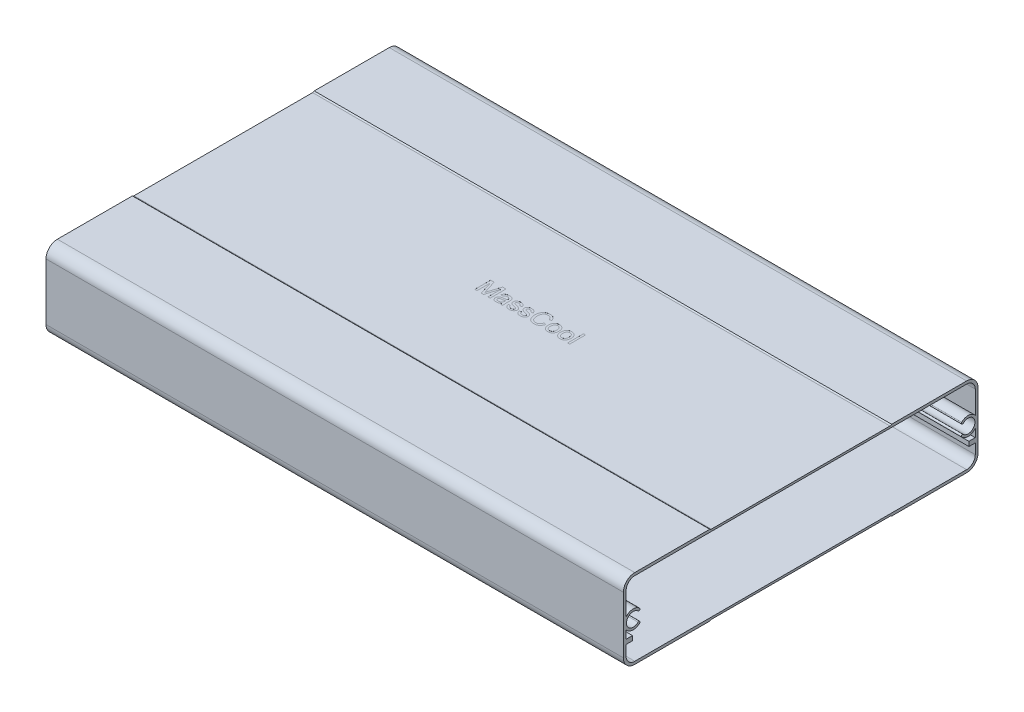
from build123d import *

# Parameters (mm, degrees)
EXTRUIR_L_MINA1_DEPTH    = 63.5
CROQUIS2_W               = 40
CROQUIS2_H               = 0.15
EXTRUIR1_DEPTH           = 134.14113752
REDONDEO1_R              = 0.5
REDONDEO1_OF_SIMETR_A1_R = 0.5
CROQUIS3_W               = 1.4
CROQUIS3_H               = 1
EXTRUIR2_DEPTH           = 127
CROQUIS4_W               = 0.448717948
CROQUIS4_H               = 3.5
EXTRUIR4_DEPTH           = 0.005


with BuildPart() as part:
    # Croquis1 → Extruir-Lámina1 (new, symmetric)
    with BuildSketch(Plane(origin=(0, 0, 0), x_dir=(0, 0, -1), z_dir=(1, 0, 0))):
        with BuildLine():
            Line((-39, -6.25), (-39, 6.25))
            ThreePointArc((-39, 6.25), (-38.267766953, 8.017766953), (-36.5, 8.75))
            Line((-36.5, 8.75), (36.5, 8.75))
            ThreePointArc((36.5, 8.75), (38.267766953, 8.017766953), (39, 6.25))
            Line((39, 6.25), (39, -6.25))
            ThreePointArc((39, -6.25), (38.267766953, -8.017766953), (36.5, -8.75))
            Line((36.5, -8.75), (-36.5, -8.75))
            ThreePointArc((-36.5, -8.75), (-38.267766953, -8.017766953), (-39, -6.25))
        make_face()
        with BuildLine():
            Line((-38.4, -6.25), (-38.4, 6.25))
            ThreePointArc((-38.4, 6.25), (-37.843502884, 7.593502884), (-36.5, 8.15))
            Line((-36.5, 8.15), (36.5, 8.15))
            ThreePointArc((36.5, 8.15), (37.843502884, 7.593502884), (38.4, 6.25))
            Line((38.4, 6.25), (38.4, -6.25))
            ThreePointArc((38.4, -6.25), (37.843502884, -7.593502884), (36.5, -8.15))
            Line((36.5, -8.15), (-36.5, -8.15))
            ThreePointArc((-36.5, -8.15), (-37.843502884, -7.593502884), (-38.4, -6.25))
        make_face(mode=Mode.SUBTRACT)
    extrude(amount=EXTRUIR_L_MINA1_DEPTH, both=True)

    # Croquis2 → Extruir1 (cut, through all)
    with BuildSketch(Plane(origin=(63.5, 0, 0), x_dir=(0, 0, -1), z_dir=(1, 0, 0))):
        with Locations((0, 8.675)):
            Rectangle(CROQUIS2_W, CROQUIS2_H)
    extruir1 = extrude(amount=-EXTRUIR1_DEPTH, mode=Mode.SUBTRACT)

    # Redondeo1
    # the kernel refuses this fillet: 0.5 mm, written as the material it adds along each edge
    with BuildSketch(Plane(origin=(63.5, 8.6, 20), x_dir=(0, 0, -1), z_dir=(-1, 0, 0))) as redondeo1_piece_1:
        with BuildLine():
            CenterArc((0.357071421, -0.5), REDONDEO1_R, 90, 45.572995999)
            Line((0, -0.15), (-0.007141428, -0.143))
            ThreePointArc((-0.007141428, -0.143), (-0.01, -0.075), (-0.01, 0))
            Line((-0.01, 0), (0, 0.01))
            Line((0, 0.01), (0.357071421, 0.01))
            Line((0.357071421, 0.01), (0.357071421, 0))
        make_face()
    extrude(amount=127)
    with BuildSketch(Plane(origin=(63.5, 8.6, -20), x_dir=(0, 1, 0), z_dir=(-1, 0, 0))) as redondeo1_piece_2:
        with BuildLine():
            CenterArc((0.5, -0.357071421), REDONDEO1_R, 134.427004001, 45.572995999)
            Line((0, -0.357071421), (-0.01, -0.357071421))
            Line((-0.01, -0.357071421), (-0.01, 0))
            Line((-0.01, 0), (0, 0.01))
            ThreePointArc((0, 0.01), (0.075, 0.01), (0.143, 0.007141428))
            Line((0.143, 0.007141428), (0.15, 0))
        make_face()
    extrude(amount=127)

    # Simetría1: Extruir1 across plane
    add(extruir1.mirror(Plane.ZX), mode=Mode.SUBTRACT)

    # Redondeo1 of Simetría1
    # the kernel refuses this fillet: 0.5 mm, written as the material it adds along each edge
    with BuildSketch(Plane(origin=(63.5, -8.6, 20), x_dir=(0, 0, -1), z_dir=(-1, 0, 0))) as redondeo1_of_simetr_a1_piece_1:
        with BuildLine():
            CenterArc((0.357071421, 0.5), REDONDEO1_OF_SIMETR_A1_R, 224.427004001, 45.572995999)
            Line((0, 0.15), (-0.007141428, 0.143))
            ThreePointArc((-0.007141428, 0.143), (-0.01, 0.075), (-0.01, 0))
            Line((-0.01, 0), (0, -0.01))
            Line((0, -0.01), (0.357071421, -0.01))
            Line((0.357071421, -0.01), (0.357071421, 0))
        make_face()
    extrude(amount=127)
    with BuildSketch(Plane(origin=(63.5, -8.6, -20), x_dir=(0, -1, 0), z_dir=(-1, 0, 0))) as redondeo1_of_simetr_a1_piece_2:
        with BuildLine():
            CenterArc((0.5, 0.357071421), REDONDEO1_OF_SIMETR_A1_R, 180, 45.572995999)
            Line((0, 0.357071421), (-0.01, 0.357071421))
            Line((-0.01, 0.357071421), (-0.01, 0))
            Line((-0.01, 0), (0, -0.01))
            ThreePointArc((0, -0.01), (0.075, -0.01), (0.143, -0.007141428))
            Line((0.143, -0.007141428), (0.15, 0))
        make_face()
    extrude(amount=127)

    # Croquis3 → Extruir2 (add, through all)
    with BuildSketch(Plane(origin=(63.5, 0, 0), x_dir=(0, 0, -1), z_dir=(1, 0, 0))):
        with Locations((-37.7, -3.5)):
            Rectangle(CROQUIS3_W, CROQUIS3_H)
        with BuildLine():
            ThreePointArc((-35.415786438, 1.414213562), (-38.83, 0), (-35.415786438, -1.414213562))
            ThreePointArc((-35.415786438, -1.414213562), (-35.415786438, -1.060660172), (-35.769339828, -1.060660172))
            ThreePointArc((-35.769339828, -1.060660172), (-38.33, 0), (-35.769339828, 1.060660172))
            ThreePointArc((-35.769339828, 1.060660172), (-35.415786438, 1.060660172), (-35.415786438, 1.414213562))
        make_face()
    extruir2 = extrude(amount=-EXTRUIR2_DEPTH)

    # Simetría2: Extruir2 across plane
    add(extruir2.mirror(Plane.XY))

    # Croquis4 → Extruir4 (cut)
    # profile 1 of 8: a face of its own
    with BuildSketch(Plane(origin=(0, 8.6, 0), x_dir=(1, 0, 0), z_dir=(0, 1, 0))):
        with BuildLine():
            Line((-8.185897436, 0), (-8.185897436, 3.5))
            Line((-8.185897436, 3.5), (-7.443409455, 3.5))
            Line((-7.443409455, 3.5), (-6.660957532, 1.043970353))
            add(Edge.make_bspline(
                [(-6.660957532, 1.043970353), (-6.652346615, 1.016147817), (-6.635693604, 0.962340652), (-6.610999163, 0.884638156), (-6.588531362, 0.812431102), (-6.56829557, 0.745489653), (-6.549198791, 0.684146169), (-6.532663989, 0.627897283), (-6.516856181, 0.577368043), (-6.507592099, 0.545255059), (-6.503205128, 0.530048077)],
                knots=[0, 0, 0, 0, 1.300204174, 2.514519184, 3.639827924, 4.676153899, 5.636536826, 6.507959918, 7.293450077, 8, 8, 8, 8], degree=3))
            add(Edge.make_bspline(
                [(-6.503205128, 0.530048077), (-6.498319061, 0.546647827), (-6.487921199, 0.581973158), (-6.471064601, 0.637516184), (-6.453128701, 0.698980793), (-6.431664927, 0.765310508), (-6.409291482, 0.837545834), (-6.38580764, 0.915626782), (-6.358719486, 0.998773807), (-6.340718053, 1.05633777), (-6.331430288, 1.08603766)],
                knots=[0, 0, 0, 0, 0.713638162, 1.518667645, 2.393860736, 3.354087503, 4.393659122, 5.512594909, 6.716633584, 8, 8, 8, 8], degree=3))
            Line((-6.331430288, 1.08603766), (-5.556690705, 3.5))
            Line((-5.556690705, 3.5), (-4.820512821, 3.5))
            Line((-4.820512821, 3.5), (-4.820512821, 0))
            Line((-4.820512821, 0), (-5.314102564, 0))
            Line((-5.314102564, 0), (-5.314102564, 2.961538462))
            Line((-5.314102564, 2.961538462), (-6.247996795, 0))
            Line((-6.247996795, 0), (-6.764022436, 0))
            Line((-6.764022436, 0), (-7.692307692, 2.961538462))
            Line((-7.692307692, 2.961538462), (-7.692307692, 0))
            Line((-7.692307692, 0), (-8.185897436, 0))
        make_face()
    # profile 2 of 8: a face of its own
    with BuildSketch(Plane(origin=(0, 8.6, 0), x_dir=(1, 0, 0), z_dir=(0, 1, 0))):
        with BuildLine():
            add(Edge.make_bspline(
                [(-2.576923077, 0.314102564), (-2.616248818, 0.283172933), (-2.692014573, 0.223583289), (-2.807758337, 0.146453271), (-2.919620071, 0.082936156), (-3.029832525, 0.034370061), (-3.140445578, -0.001024815), (-3.253289798, -0.026270517), (-3.37012987, -0.042339805), (-3.449533452, -0.044020062), (-3.489783654, -0.044871795)],
                knots=[0, 0, 0, 0, 1.197047628, 2.306255791, 3.325459075, 4.272204958, 5.183179809, 6.100503351, 7.037132558, 8, 8, 8, 8], degree=3))
            add(Edge.make_bspline(
                [(-3.489783654, -0.044871795), (-3.522521062, -0.044108535), (-3.586022182, -0.042628032), (-3.678462159, -0.033784669), (-3.765010282, -0.017667492), (-3.845812283, 0.004956473), (-3.921437222, 0.032427705), (-3.990540172, 0.068029392), (-4.054064675, 0.109257027), (-4.110883004, 0.157218259), (-4.161246611, 0.209938232), (-4.205842419, 0.266009361), (-4.243079755, 0.32617906), (-4.274240742, 0.389446448), (-4.298267992, 0.456708627), (-4.314854875, 0.527512417), (-4.324836664, 0.601746108), (-4.326218684, 0.652245857), (-4.326923077, 0.677984776)],
                knots=[0, 0, 0, 0, 1.258692688, 2.441500428, 3.565802525, 4.638326649, 5.664695568, 6.653201623, 7.620115754, 8.570354797, 9.504485475, 10.41940588, 11.319425392, 12.219534596, 13.126122865, 14.058869773, 15.010636805, 16, 16, 16, 16], degree=3))
            add(Edge.make_bspline(
                [(-4.326923077, 0.677984776), (-4.326086635, 0.708440258), (-4.324441068, 0.768356574), (-4.308247977, 0.855868026), (-4.283298472, 0.939452308), (-4.247151628, 1.017780048), (-4.203294008, 1.090402939), (-4.152307614, 1.156108629), (-4.095671309, 1.21486292), (-4.031561948, 1.264739675), (-3.962775365, 1.307804815), (-3.890033703, 1.346143112), (-3.813017394, 1.378388345), (-3.759393832, 1.39518277), (-3.732371795, 1.403645833)],
                knots=[0, 0, 0, 0, 1.081160721, 2.127011708, 3.15154375, 4.173548368, 5.183333295, 6.160067524, 7.123185218, 8.075175306, 9.03822139, 10.004020623, 10.994184154, 12, 12, 12, 12], degree=3))
            add(Edge.make_bspline(
                [(-3.732371795, 1.403645833), (-3.709526467, 1.409517335), (-3.658793207, 1.422556344), (-3.574080016, 1.437588856), (-3.474144813, 1.454192603), (-3.402183811, 1.463276278), (-3.363581731, 1.468149038)],
                knots=[0, 0, 0, 0, 0.755247122, 1.677198421, 2.753978269, 4, 4, 4, 4], degree=3))
            add(Edge.make_bspline(
                [(-3.363581731, 1.468149038), (-3.323143643, 1.473471342), (-3.245021924, 1.483753419), (-3.131774026, 1.499533529), (-3.026844947, 1.517064031), (-2.930163546, 1.535503145), (-2.841565803, 1.553158117), (-2.76168623, 1.572980318), (-2.689787671, 1.593020975), (-2.645106971, 1.608186125), (-2.623898237, 1.615384615)],
                knots=[0, 0, 0, 0, 1.295688514, 2.50312072, 3.632112522, 4.674678079, 5.629835945, 6.501350263, 7.28863104, 8, 8, 8, 8], degree=3))
            add(Edge.make_bspline(
                [(-2.623898237, 1.615384615), (-2.623661038, 1.627771029), (-2.623231377, 1.650207725), (-2.622704288, 1.680126268), (-2.621674077, 1.702551814), (-2.621760599, 1.714943354), (-2.621794872, 1.719851763)],
                knots=[0, 0, 0, 0, 1.422721786, 2.577112132, 3.436380362, 4, 4, 4, 4], degree=3))
            add(Edge.make_bspline(
                [(-2.621794872, 1.719851763), (-2.622303414, 1.739489586), (-2.623279744, 1.777191463), (-2.627774744, 1.831654535), (-2.637009102, 1.881593105), (-2.649452578, 1.927171547), (-2.665244929, 1.968482926), (-2.686165019, 2.004221394), (-2.70902272, 2.036843141), (-2.728031273, 2.054583258), (-2.737479968, 2.063401442)],
                knots=[0, 0, 0, 0, 1.26154989, 2.42199954, 3.505345601, 4.517638791, 5.454101631, 6.334651141, 7.172195178, 8, 8, 8, 8], degree=3))
            add(Edge.make_bspline(
                [(-2.737479968, 2.063401442), (-2.750994297, 2.074316702), (-2.778627941, 2.096635858), (-2.826196877, 2.123150851), (-2.877191579, 2.147472919), (-2.933509403, 2.166323876), (-2.994310104, 2.180802164), (-3.05993528, 2.191247639), (-3.130215638, 2.197607533), (-3.178705329, 2.198339998), (-3.203725962, 2.198717949)],
                knots=[0, 0, 0, 0, 0.839762797, 1.717118621, 2.62848608, 3.573318781, 4.586191294, 5.652292021, 6.78858503, 8, 8, 8, 8], degree=3))
            add(Edge.make_bspline(
                [(-3.203725962, 2.198717949), (-3.227104276, 2.198479218), (-3.272032023, 2.198020432), (-3.337306348, 2.193664544), (-3.397724955, 2.186957522), (-3.453701192, 2.177125028), (-3.504506542, 2.164621166), (-3.551098528, 2.149898481), (-3.592829591, 2.132054972), (-3.642435488, 2.103392712), (-3.698256079, 2.05745826), (-3.752907416, 1.984718908), (-3.800877402, 1.896927182), (-3.822107666, 1.830170114), (-3.833333333, 1.794871795)],
                knots=[0, 0, 0, 0, 1.022193202, 1.964420342, 2.859404845, 3.679355848, 4.447752811, 5.145854219, 5.814144269, 6.427678132, 7.647232431, 8.943346363, 10.383770637, 12, 12, 12, 12], degree=3))
            Line((-3.833333333, 1.794871795), (-4.282051282, 1.83974359))
            add(Edge.make_bspline(
                [(-4.282051282, 1.83974359), (-4.271755374, 1.88184837), (-4.251874605, 1.963150128), (-4.208130185, 2.076542567), (-4.155184819, 2.177244486), (-4.093154919, 2.26713918), (-4.016909118, 2.344677067), (-3.927477232, 2.412930671), (-3.822525365, 2.469833794), (-3.704253725, 2.518114416), (-3.573590155, 2.556178227), (-3.432044753, 2.583232744), (-3.280757372, 2.599391614), (-3.176656528, 2.601486361), (-3.123096955, 2.602564103)],
                knots=[0, 0, 0, 0, 1.021253436, 1.971977998, 2.856928585, 3.699335328, 4.537187707, 5.410097588, 6.342486875, 7.343316183, 8.417452201, 9.545747471, 10.737294414, 12, 12, 12, 12], degree=3))
            add(Edge.make_bspline(
                [(-3.123096955, 2.602564103), (-3.070713874, 2.601648518), (-2.970884667, 2.59990364), (-2.828975689, 2.586217164), (-2.702268737, 2.562967528), (-2.591054268, 2.529287948), (-2.494378014, 2.488319418), (-2.410909274, 2.443235009), (-2.341038784, 2.392543899), (-2.284089281, 2.335921734), (-2.238402431, 2.272575511), (-2.201469217, 2.202489752), (-2.170621389, 2.125241487), (-2.156988167, 2.070149019), (-2.149939904, 2.041666667)],
                knots=[0, 0, 0, 0, 1.532418085, 2.920410157, 4.166262907, 5.295392887, 6.3126657, 7.233843889, 8.065362582, 8.82930282, 9.573337446, 10.341184706, 11.142406151, 12, 12, 12, 12], degree=3))
            add(Edge.make_bspline(
                [(-2.149939904, 2.041666667), (-2.146315784, 2.019972934), (-2.137977637, 1.970061364), (-2.133315773, 1.884184635), (-2.12865643, 1.778100821), (-2.128364325, 1.700464733), (-2.128205128, 1.658153045)],
                knots=[0, 0, 0, 0, 0.685842966, 1.577944182, 2.67997895, 4, 4, 4, 4], degree=3))
            Line((-2.128205128, 1.658153045), (-2.128205128, 1.110576923))
            add(Edge.make_bspline(
                [(-2.128205128, 1.110576923), (-2.127947136, 1.064770409), (-2.127454845, 0.977363986), (-2.127130078, 0.852323027), (-2.125202697, 0.739656375), (-2.121296766, 0.638951045), (-2.118070729, 0.550354542), (-2.114171159, 0.473644993), (-2.108607829, 0.409354942), (-2.100376774, 0.339930966), (-2.086024908, 0.262085488), (-2.061710003, 0.172768826), (-2.032161723, 0.084759209), (-2.006473732, 0.028311657), (-1.993589744, 0)],
                knots=[0, 0, 0, 0, 1.460752392, 2.787357723, 3.987454144, 5.053844556, 6.001073417, 6.814649835, 7.502887566, 8.058452826, 9.043678907, 10.023506295, 11.008675999, 12, 12, 12, 12], degree=3))
            Line((-1.993589744, 0), (-2.442307692, 0))
            add(Edge.make_bspline(
                [(-2.442307692, 0), (-2.458916947, 0.022933991), (-2.492110451, 0.068767446), (-2.529268841, 0.145901761), (-2.559863266, 0.22736247), (-2.571179961, 0.284901866), (-2.576923077, 0.314102564)],
                knots=[0, 0, 0, 0, 0.98283144, 1.964183219, 2.966842269, 4, 4, 4, 4], degree=3))
        make_face()
        with BuildLine():
            add(Edge.make_bspline(
                [(-2.621794872, 1.211538462), (-2.641578675, 1.204500718), (-2.683330103, 1.189648375), (-2.750671591, 1.171766266), (-2.824249699, 1.152127669), (-2.905403079, 1.135251535), (-2.99313259, 1.117379239), (-3.088371443, 1.101523741), (-3.190283985, 1.086126652), (-3.260734276, 1.076808597), (-3.29697516, 1.072015224)],
                knots=[0, 0, 0, 0, 0.729352295, 1.539213581, 2.419656264, 3.375381672, 4.41857158, 5.530700671, 6.729748458, 8, 8, 8, 8], degree=3))
            add(Edge.make_bspline(
                [(-3.29697516, 1.072015224), (-3.336523606, 1.066747519), (-3.409518951, 1.057024811), (-3.509153586, 1.038861187), (-3.590254555, 1.020348509), (-3.655058521, 1.000789442), (-3.707712591, 0.977728488), (-3.751328109, 0.949083195), (-3.789982121, 0.916955247), (-3.821384035, 0.87936939), (-3.847032932, 0.838990713), (-3.864314466, 0.795361176), (-3.876494515, 0.750160247), (-3.877631461, 0.718965197), (-3.878205128, 0.70322516)],
                knots=[0, 0, 0, 0, 1.886220442, 3.481434204, 4.78676141, 5.817751327, 6.678319802, 7.493641666, 8.277504993, 9.045791761, 9.800124555, 10.528599956, 11.257578043, 12, 12, 12, 12], degree=3))
            add(Edge.make_bspline(
                [(-3.878205128, 0.70322516), (-3.876883272, 0.679390549), (-3.8742853, 0.632546093), (-3.848702015, 0.566340287), (-3.808888523, 0.506459646), (-3.753519544, 0.45350231), (-3.68222084, 0.410716546), (-3.596314878, 0.379982388), (-3.496346254, 0.362263467), (-3.425121711, 0.360112792), (-3.387419872, 0.358974359)],
                knots=[0, 0, 0, 0, 0.849267971, 1.669148087, 2.501462232, 3.405991702, 4.385156294, 5.453560725, 6.652073551, 8, 8, 8, 8], degree=3))
            add(Edge.make_bspline(
                [(-3.387419872, 0.358974359), (-3.348753467, 0.359990651), (-3.27295862, 0.361982812), (-3.162833348, 0.3834258), (-3.058784568, 0.415821541), (-2.96315563, 0.462572735), (-2.876749165, 0.517942573), (-2.801948213, 0.58068383), (-2.738244421, 0.649101318), (-2.706313124, 0.700778308), (-2.690504808, 0.726362179)],
                knots=[0, 0, 0, 0, 1.124426932, 2.204129629, 3.254288104, 4.289056288, 5.293189312, 6.235005055, 7.126199027, 8, 8, 8, 8], degree=3))
            add(Edge.make_bspline(
                [(-2.690504808, 0.726362179), (-2.679844885, 0.748494465), (-2.656922274, 0.79608672), (-2.638884729, 0.879430716), (-2.625691442, 0.975521745), (-2.62452236, 1.044373029), (-2.623898237, 1.081129808)],
                knots=[0, 0, 0, 0, 0.806621552, 1.73452216, 2.790557523, 4, 4, 4, 4], degree=3))
            Line((-2.623898237, 1.081129808), (-2.621794872, 1.211538462))
        make_face(mode=Mode.SUBTRACT)
    # profile 3 of 8: a face of its own
    with BuildSketch(Plane(origin=(0, 8.6, 0), x_dir=(1, 0, 0), z_dir=(0, 1, 0))):
        with BuildLine():
            Line((-1.634615385, 0.807692308), (-1.185897436, 0.852564103))
            add(Edge.make_bspline(
                [(-1.185897436, 0.852564103), (-1.179043643, 0.814590177), (-1.16591743, 0.741863469), (-1.125602898, 0.641635466), (-1.071210525, 0.554951113), (-1.012622701, 0.494566819), (-0.958135356, 0.455663093), (-0.913821178, 0.429246416), (-0.865107158, 0.407913494), (-0.81318371, 0.389457753), (-0.757308652, 0.375472937), (-0.697506792, 0.36575554), (-0.633748581, 0.360306353), (-0.58995401, 0.359425713), (-0.567508013, 0.358974359)],
                knots=[0, 0, 0, 0, 1.576426584, 3.019132651, 4.39139761, 5.744583744, 6.429748217, 7.128801231, 7.852561526, 8.603024018, 9.382742032, 10.206978913, 11.081024327, 12, 12, 12, 12], degree=3))
            add(Edge.make_bspline(
                [(-0.567508013, 0.358974359), (-0.545056132, 0.359090719), (-0.501477206, 0.359316574), (-0.438551119, 0.365397146), (-0.379945798, 0.373480416), (-0.325929767, 0.385165299), (-0.276615616, 0.40089548), (-0.231122476, 0.418721833), (-0.190627429, 0.441263872), (-0.143681075, 0.474334229), (-0.095277154, 0.521170879), (-0.051082563, 0.583297227), (-0.023933567, 0.651591474), (-0.020803795, 0.699019313), (-0.019230769, 0.722856571)],
                knots=[0, 0, 0, 0, 1.101207713, 2.137435615, 3.099211963, 4.003546554, 4.845050796, 5.637285753, 6.396976949, 7.112904354, 8.451176697, 9.67915534, 10.8335422, 12, 12, 12, 12], degree=3))
            add(Edge.make_bspline(
                [(-0.019230769, 0.722856571), (-0.019484057, 0.733665971), (-0.019981221, 0.754883085), (-0.028379684, 0.785284481), (-0.040311904, 0.814018646), (-0.057529493, 0.840905058), (-0.079342254, 0.866049718), (-0.10592732, 0.889655423), (-0.137337041, 0.911162133), (-0.16071901, 0.923384674), (-0.172776442, 0.9296875)],
                knots=[0, 0, 0, 0, 0.948511305, 1.861774925, 2.756066261, 3.680846901, 4.658374041, 5.678500434, 6.80286706, 8, 8, 8, 8], degree=3))
            add(Edge.make_bspline(
                [(-0.172776442, 0.9296875), (-0.182778108, 0.934243588), (-0.204633013, 0.944199215), (-0.241399796, 0.957737109), (-0.284062217, 0.973723947), (-0.33381652, 0.98831714), (-0.389557882, 1.005491994), (-0.451768535, 1.023983055), (-0.521027325, 1.041535607), (-0.569155045, 1.054213098), (-0.594150641, 1.060797276)],
                knots=[0, 0, 0, 0, 0.596822396, 1.30413245, 2.127382897, 3.071041962, 4.119245502, 5.296370109, 6.595843667, 8, 8, 8, 8], degree=3))
            add(Edge.make_bspline(
                [(-0.594150641, 1.060797276), (-0.628289788, 1.070786271), (-0.69407564, 1.090034982), (-0.788730834, 1.118786236), (-0.876182413, 1.146234048), (-0.956487438, 1.172501358), (-1.029274094, 1.198615852), (-1.094905153, 1.222940788), (-1.152934592, 1.246996745), (-1.220242316, 1.275715787), (-1.29430878, 1.316123756), (-1.372660462, 1.373140078), (-1.438966786, 1.439685161), (-1.493972294, 1.513616454), (-1.537149251, 1.593927662), (-1.567037439, 1.679407762), (-1.586144753, 1.768792192), (-1.588532838, 1.829830835), (-1.58974359, 1.860777244)],
                knots=[0, 0, 0, 0, 1.22605552, 2.362598816, 3.409724438, 4.385374865, 5.274589806, 6.075051486, 6.797583358, 7.439654886, 8.596878446, 9.697305961, 10.768176168, 11.821850251, 12.863383541, 13.897821176, 14.934201653, 16, 16, 16, 16], degree=3))
            add(Edge.make_bspline(
                [(-1.58974359, 1.860777244), (-1.588773194, 1.888882567), (-1.586852524, 1.944510438), (-1.572367897, 2.026158023), (-1.549301992, 2.104927941), (-1.51599705, 2.179759045), (-1.475197835, 2.250371308), (-1.425908262, 2.31435767), (-1.371693869, 2.373592521), (-1.329654024, 2.406561026), (-1.30859375, 2.423076923)],
                knots=[0, 0, 0, 0, 1.034021226, 2.046601578, 3.042752055, 4.048071569, 5.054273975, 6.036661087, 7.016446045, 8, 8, 8, 8], degree=3))
            add(Edge.make_bspline(
                [(-1.30859375, 2.423076923), (-1.29104092, 2.435322972), (-1.254264138, 2.460980958), (-1.192108762, 2.494555173), (-1.120778928, 2.524406287), (-1.041797343, 2.551150743), (-0.957041523, 2.574684656), (-0.868029843, 2.590215459), (-0.776215768, 2.600522884), (-0.714071492, 2.60187633), (-0.682491987, 2.602564103)],
                knots=[0, 0, 0, 0, 0.776203524, 1.626305774, 2.557252601, 3.57906176, 4.650888526, 5.745456612, 6.854321437, 8, 8, 8, 8], degree=3))
            add(Edge.make_bspline(
                [(-0.682491987, 2.602564103), (-0.635471882, 2.601484033), (-0.544179926, 2.599387021), (-0.411720583, 2.58329884), (-0.288242882, 2.555910991), (-0.174402056, 2.518577246), (-0.072021203, 2.471898318), (0.017652976, 2.417554432), (0.09211846, 2.353762639), (0.153541395, 2.281892621), (0.202790882, 2.199439786), (0.242207346, 2.105588312), (0.273898659, 1.999502492), (0.287673554, 1.924046068), (0.294871795, 1.884615385)],
                knots=[0, 0, 0, 0, 1.253394935, 2.433530808, 3.550681177, 4.620594829, 5.621516506, 6.544862206, 7.406547904, 8.22431151, 9.054607538, 9.956211395, 10.931993099, 12, 12, 12, 12], degree=3))
            Line((0.294871795, 1.884615385), (-0.153846154, 1.83974359))
            add(Edge.make_bspline(
                [(-0.153846154, 1.83974359), (-0.159184476, 1.86665571), (-0.169542804, 1.918875225), (-0.200903825, 1.991161225), (-0.245436465, 2.053389357), (-0.30199118, 2.106210839), (-0.370792952, 2.148908896), (-0.45303122, 2.177841566), (-0.547045094, 2.196392842), (-0.614150198, 2.197915139), (-0.649539263, 2.198717949)],
                knots=[0, 0, 0, 0, 0.971549383, 1.88516682, 2.771115596, 3.668786025, 4.614654303, 5.622170142, 6.746009326, 8, 8, 8, 8], degree=3))
            add(Edge.make_bspline(
                [(-0.649539263, 2.198717949), (-0.670812687, 2.19846492), (-0.711768397, 2.197977788), (-0.771005599, 2.193818491), (-0.825463283, 2.186631607), (-0.875618906, 2.17820423), (-0.920417752, 2.165162976), (-0.961158984, 2.150843045), (-0.996707575, 2.132507018), (-1.037024413, 2.106242193), (-1.077140055, 2.068213196), (-1.114629631, 2.018827641), (-1.136989675, 1.963723799), (-1.139680824, 1.925467535), (-1.141025641, 1.90635016)],
                knots=[0, 0, 0, 0, 1.202032812, 2.314159929, 3.352655878, 4.305866621, 5.183839704, 5.986040797, 6.742017283, 7.437935182, 8.699432998, 9.843179159, 10.922196019, 12, 12, 12, 12], degree=3))
            add(Edge.make_bspline(
                [(-1.141025641, 1.90635016), (-1.140574396, 1.894130541), (-1.139684524, 1.870033017), (-1.129941388, 1.835250911), (-1.115148991, 1.802256745), (-1.101179387, 1.782511966), (-1.094050481, 1.772435897)],
                knots=[0, 0, 0, 0, 1.012137305, 1.99597066, 2.977312565, 4, 4, 4, 4], degree=3))
            add(Edge.make_bspline(
                [(-1.094050481, 1.772435897), (-1.085503163, 1.76227856), (-1.067717111, 1.741142231), (-1.032884691, 1.714846113), (-0.992353281, 1.690135113), (-0.961962168, 1.67694862), (-0.946113782, 1.670072115)],
                knots=[0, 0, 0, 0, 0.873299099, 1.81724178, 2.861733162, 4, 4, 4, 4], degree=3))
            add(Edge.make_bspline(
                [(-0.946113782, 1.670072115), (-0.940050057, 1.667930482), (-0.925900699, 1.662933102), (-0.90079248, 1.655286235), (-0.869070434, 1.645499395), (-0.829962482, 1.634309107), (-0.784219768, 1.620998624), (-0.731095927, 1.606295055), (-0.671328859, 1.589478784), (-0.628982316, 1.577957942), (-0.606770833, 1.571915064)],
                knots=[0, 0, 0, 0, 0.436802817, 1.019254657, 1.782618184, 2.69198815, 3.782349451, 5.018834001, 6.436327698, 8, 8, 8, 8], degree=3))
            add(Edge.make_bspline(
                [(-0.606770833, 1.571915064), (-0.573798983, 1.561927617), (-0.510124404, 1.54264006), (-0.417899203, 1.513602539), (-0.332036756, 1.486544292), (-0.252784868, 1.460660556), (-0.180196836, 1.435834029), (-0.113923334, 1.413070795), (-0.054158425, 1.391128553), (0.015943035, 1.364860398), (0.095585218, 1.329464547), (0.180085299, 1.275793356), (0.254154352, 1.213476183), (0.317006694, 1.142462278), (0.368075898, 1.062158243), (0.403448953, 0.971946482), (0.426079316, 0.87307076), (0.428326036, 0.804083376), (0.429487179, 0.768429487)],
                knots=[0, 0, 0, 0, 1.155996739, 2.232437775, 3.244329082, 4.176768736, 5.029854173, 5.818511279, 6.528027969, 7.165934889, 8.330913826, 9.444808892, 10.513164249, 11.568838208, 12.615385132, 13.688622127, 14.805439433, 16, 16, 16, 16], degree=3))
            add(Edge.make_bspline(
                [(0.429487179, 0.768429487), (0.428032728, 0.73254155), (0.425131261, 0.660949169), (0.4007459, 0.555721002), (0.362708744, 0.453320989), (0.308716277, 0.355874983), (0.240775549, 0.264783702), (0.157813894, 0.184346272), (0.061043064, 0.114977844), (-0.048223087, 0.05767444), (-0.16748696, 0.010802312), (-0.295897951, -0.020232961), (-0.431454108, -0.041996761), (-0.524647226, -0.043897513), (-0.572415865, -0.044871795)],
                knots=[0, 0, 0, 0, 0.894809563, 1.785044015, 2.682170314, 3.614214614, 4.555721535, 5.508634546, 6.486485836, 7.51727745, 8.581064401, 9.676123613, 10.808834633, 12, 12, 12, 12], degree=3))
            add(Edge.make_bspline(
                [(-0.572415865, -0.044871795), (-0.61169902, -0.044179468), (-0.687822574, -0.042837866), (-0.798424737, -0.033064683), (-0.901836476, -0.01646741), (-0.99798464, 0.007275091), (-1.086922085, 0.03747188), (-1.168901699, 0.073816686), (-1.243745015, 0.117465056), (-1.311411579, 0.168161656), (-1.372342168, 0.225941328), (-1.427786778, 0.289619704), (-1.4771203, 0.36013902), (-1.519716672, 0.437325474), (-1.557908903, 0.520362919), (-1.589986149, 0.610203791), (-1.615992467, 0.706620958), (-1.628309693, 0.773469704), (-1.634615385, 0.807692308)],
                knots=[0, 0, 0, 0, 1.244406412, 2.411431524, 3.514215425, 4.559320282, 5.545040859, 6.48623969, 7.395443761, 8.283912081, 9.158607275, 10.050831307, 10.954592804, 11.879399228, 12.840196462, 13.8472361, 14.897912238, 16, 16, 16, 16], degree=3))
        make_face()
    # profile 4 of 8: a face of its own
    with BuildSketch(Plane(origin=(0, 8.6, 0), x_dir=(1, 0, 0), z_dir=(0, 1, 0))):
        with BuildLine():
            Line((0.788461538, 0.807692308), (1.237179487, 0.852564103))
            add(Edge.make_bspline(
                [(1.237179487, 0.852564103), (1.24403328, 0.814590177), (1.257159493, 0.741863469), (1.297474025, 0.641635466), (1.351866399, 0.554951113), (1.410454222, 0.494566819), (1.464941567, 0.455663093), (1.509255745, 0.429246416), (1.557969765, 0.407913494), (1.609893213, 0.389457753), (1.665768272, 0.375472937), (1.725570131, 0.36575554), (1.789328342, 0.360306353), (1.833122913, 0.359425713), (1.85556891, 0.358974359)],
                knots=[0, 0, 0, 0, 1.576426584, 3.019132651, 4.39139761, 5.744583744, 6.429748217, 7.128801231, 7.852561526, 8.603024018, 9.382742032, 10.206978913, 11.081024327, 12, 12, 12, 12], degree=3))
            add(Edge.make_bspline(
                [(1.85556891, 0.358974359), (1.878020791, 0.359090719), (1.921599717, 0.359316574), (1.984525804, 0.365397146), (2.043131125, 0.373480416), (2.097147156, 0.385165299), (2.146461307, 0.40089548), (2.191954447, 0.418721833), (2.232449495, 0.441263872), (2.279395848, 0.474334229), (2.327799769, 0.521170879), (2.37199436, 0.583297227), (2.399143356, 0.651591474), (2.402273129, 0.699019313), (2.403846154, 0.722856571)],
                knots=[0, 0, 0, 0, 1.101207713, 2.137435615, 3.099211963, 4.003546554, 4.845050796, 5.637285753, 6.396976949, 7.112904354, 8.451176697, 9.67915534, 10.8335422, 12, 12, 12, 12], degree=3))
            add(Edge.make_bspline(
                [(2.403846154, 0.722856571), (2.403592866, 0.733665971), (2.403095702, 0.754883085), (2.394697239, 0.785284481), (2.382765019, 0.814018646), (2.36554743, 0.840905058), (2.343734669, 0.866049718), (2.317149603, 0.889655423), (2.285739882, 0.911162133), (2.262357914, 0.923384674), (2.250300481, 0.9296875)],
                knots=[0, 0, 0, 0, 0.948511305, 1.861774925, 2.756066261, 3.680846901, 4.658374041, 5.678500434, 6.80286706, 8, 8, 8, 8], degree=3))
            add(Edge.make_bspline(
                [(2.250300481, 0.9296875), (2.240298815, 0.934243588), (2.21844391, 0.944199215), (2.181677127, 0.957737109), (2.139014706, 0.973723947), (2.089260403, 0.98831714), (2.033519041, 1.005491994), (1.971308388, 1.023983055), (1.902049598, 1.041535607), (1.853921879, 1.054213098), (1.828926282, 1.060797276)],
                knots=[0, 0, 0, 0, 0.596822396, 1.30413245, 2.127382897, 3.071041962, 4.119245502, 5.296370109, 6.595843667, 8, 8, 8, 8], degree=3))
            add(Edge.make_bspline(
                [(1.828926282, 1.060797276), (1.794787135, 1.070786271), (1.729001283, 1.090034982), (1.634346089, 1.118786236), (1.54689451, 1.146234048), (1.466589485, 1.172501358), (1.393802829, 1.198615852), (1.32817177, 1.222940788), (1.270142331, 1.246996745), (1.202834607, 1.275715787), (1.128768143, 1.316123756), (1.050416461, 1.373140078), (0.984110137, 1.439685161), (0.929104629, 1.513616454), (0.885927672, 1.593927662), (0.856039484, 1.679407762), (0.83693217, 1.768792192), (0.834544085, 1.829830835), (0.833333333, 1.860777244)],
                knots=[0, 0, 0, 0, 1.22605552, 2.362598816, 3.409724438, 4.385374865, 5.274589806, 6.075051486, 6.797583358, 7.439654886, 8.596878446, 9.697305961, 10.768176168, 11.821850251, 12.863383541, 13.897821176, 14.934201653, 16, 16, 16, 16], degree=3))
            add(Edge.make_bspline(
                [(0.833333333, 1.860777244), (0.834303729, 1.888882567), (0.836224399, 1.944510438), (0.850709026, 2.026158023), (0.873774931, 2.104927941), (0.907079873, 2.179759045), (0.947879088, 2.250371308), (0.997168661, 2.31435767), (1.051383054, 2.373592521), (1.093422899, 2.406561026), (1.114483173, 2.423076923)],
                knots=[0, 0, 0, 0, 1.034021226, 2.046601578, 3.042752055, 4.048071569, 5.054273975, 6.036661087, 7.016446045, 8, 8, 8, 8], degree=3))
            add(Edge.make_bspline(
                [(1.114483173, 2.423076923), (1.132036003, 2.435322972), (1.168812785, 2.460980958), (1.230968161, 2.494555173), (1.302297995, 2.524406287), (1.38127958, 2.551150743), (1.4660354, 2.574684656), (1.55504708, 2.590215459), (1.646861155, 2.600522884), (1.709005431, 2.60187633), (1.740584936, 2.602564103)],
                knots=[0, 0, 0, 0, 0.776203524, 1.626305774, 2.557252601, 3.57906176, 4.650888526, 5.745456612, 6.854321437, 8, 8, 8, 8], degree=3))
            add(Edge.make_bspline(
                [(1.740584936, 2.602564103), (1.787605041, 2.601484033), (1.878896997, 2.599387021), (2.01135634, 2.58329884), (2.134834041, 2.555910991), (2.248674867, 2.518577246), (2.35105572, 2.471898318), (2.440729899, 2.417554432), (2.515195383, 2.353762639), (2.576618318, 2.281892621), (2.625867805, 2.199439786), (2.665284269, 2.105588312), (2.696975582, 1.999502492), (2.710750477, 1.924046068), (2.717948718, 1.884615385)],
                knots=[0, 0, 0, 0, 1.253394935, 2.433530808, 3.550681177, 4.620594829, 5.621516506, 6.544862206, 7.406547904, 8.22431151, 9.054607538, 9.956211395, 10.931993099, 12, 12, 12, 12], degree=3))
            Line((2.717948718, 1.884615385), (2.269230769, 1.83974359))
            add(Edge.make_bspline(
                [(2.269230769, 1.83974359), (2.263892447, 1.86665571), (2.253534119, 1.918875225), (2.222173098, 1.991161225), (2.177640458, 2.053389357), (2.121085743, 2.106210839), (2.052283972, 2.148908896), (1.970045703, 2.177841566), (1.876031829, 2.196392842), (1.808926725, 2.197915139), (1.77353766, 2.198717949)],
                knots=[0, 0, 0, 0, 0.971549383, 1.88516682, 2.771115596, 3.668786025, 4.614654303, 5.622170142, 6.746009326, 8, 8, 8, 8], degree=3))
            add(Edge.make_bspline(
                [(1.77353766, 2.198717949), (1.752264236, 2.19846492), (1.711308526, 2.197977788), (1.652071324, 2.193818491), (1.59761364, 2.186631607), (1.547458017, 2.17820423), (1.502659171, 2.165162976), (1.461917939, 2.150843045), (1.426369349, 2.132507018), (1.38605251, 2.106242193), (1.345936869, 2.068213196), (1.308447292, 2.018827641), (1.286087248, 1.963723799), (1.2833961, 1.925467535), (1.282051282, 1.90635016)],
                knots=[0, 0, 0, 0, 1.202032812, 2.314159929, 3.352655878, 4.305866621, 5.183839704, 5.986040797, 6.742017283, 7.437935182, 8.699432998, 9.843179159, 10.922196019, 12, 12, 12, 12], degree=3))
            add(Edge.make_bspline(
                [(1.282051282, 1.90635016), (1.282502527, 1.894130541), (1.283392399, 1.870033017), (1.293135535, 1.835250911), (1.307927933, 1.802256745), (1.321897536, 1.782511966), (1.329026442, 1.772435897)],
                knots=[0, 0, 0, 0, 1.012137305, 1.99597066, 2.977312565, 4, 4, 4, 4], degree=3))
            add(Edge.make_bspline(
                [(1.329026442, 1.772435897), (1.33757376, 1.76227856), (1.355359812, 1.741142231), (1.390192232, 1.714846113), (1.430723642, 1.690135113), (1.461114755, 1.67694862), (1.476963141, 1.670072115)],
                knots=[0, 0, 0, 0, 0.873299099, 1.81724178, 2.861733162, 4, 4, 4, 4], degree=3))
            add(Edge.make_bspline(
                [(1.476963141, 1.670072115), (1.483026866, 1.667930482), (1.497176224, 1.662933102), (1.522284443, 1.655286235), (1.554006489, 1.645499395), (1.593114441, 1.634309107), (1.638857155, 1.620998624), (1.691980996, 1.606295055), (1.751748064, 1.589478784), (1.794094607, 1.577957942), (1.81630609, 1.571915064)],
                knots=[0, 0, 0, 0, 0.436802817, 1.019254657, 1.782618184, 2.69198815, 3.782349451, 5.018834001, 6.436327698, 8, 8, 8, 8], degree=3))
            add(Edge.make_bspline(
                [(1.81630609, 1.571915064), (1.84927794, 1.561927617), (1.912952519, 1.54264006), (2.00517772, 1.513602539), (2.091040167, 1.486544292), (2.170292055, 1.460660556), (2.242880087, 1.435834029), (2.309153589, 1.413070795), (2.368918498, 1.391128553), (2.439019958, 1.364860398), (2.518662141, 1.329464547), (2.603162222, 1.275793356), (2.677231275, 1.213476183), (2.740083617, 1.142462278), (2.791152822, 1.062158243), (2.826525876, 0.971946482), (2.849156239, 0.87307076), (2.851402959, 0.804083376), (2.852564103, 0.768429487)],
                knots=[0, 0, 0, 0, 1.155996739, 2.232437775, 3.244329082, 4.176768736, 5.029854173, 5.818511279, 6.528027969, 7.165934889, 8.330913826, 9.444808892, 10.513164249, 11.568838208, 12.615385132, 13.688622127, 14.805439433, 16, 16, 16, 16], degree=3))
            add(Edge.make_bspline(
                [(2.852564103, 0.768429487), (2.851109651, 0.73254155), (2.848208184, 0.660949169), (2.823822823, 0.555721002), (2.785785668, 0.453320989), (2.7317932, 0.355874983), (2.663852472, 0.264783702), (2.580890817, 0.184346272), (2.484119987, 0.114977844), (2.374853836, 0.05767444), (2.255589963, 0.010802312), (2.127178972, -0.020232961), (1.991622815, -0.041996761), (1.898429697, -0.043897513), (1.850661058, -0.044871795)],
                knots=[0, 0, 0, 0, 0.894809563, 1.785044015, 2.682170314, 3.614214614, 4.555721535, 5.508634546, 6.486485836, 7.51727745, 8.581064401, 9.676123613, 10.808834633, 12, 12, 12, 12], degree=3))
            add(Edge.make_bspline(
                [(1.850661058, -0.044871795), (1.811377903, -0.044179468), (1.735254349, -0.042837866), (1.624652186, -0.033064683), (1.521240447, -0.01646741), (1.425092283, 0.007275091), (1.336154838, 0.03747188), (1.254175224, 0.073816686), (1.179331908, 0.117465056), (1.111665344, 0.168161656), (1.050734755, 0.225941328), (0.995290145, 0.289619704), (0.945956623, 0.36013902), (0.903360251, 0.437325474), (0.86516802, 0.520362919), (0.833090774, 0.610203791), (0.807084456, 0.706620958), (0.79476723, 0.773469704), (0.788461538, 0.807692308)],
                knots=[0, 0, 0, 0, 1.244406412, 2.411431524, 3.514215425, 4.559320282, 5.545040859, 6.48623969, 7.395443761, 8.283912081, 9.158607275, 10.050831307, 10.954592804, 11.879399228, 12.840196462, 13.8472361, 14.897912238, 16, 16, 16, 16], degree=3))
        make_face()
    # profile 5 of 8: a face of its own
    with BuildSketch(Plane(origin=(0, 8.6, 0), x_dir=(1, 0, 0), z_dir=(0, 1, 0))):
        with BuildLine():
            Line((5.814102564, 1.235376603), (6.307692308, 1.120392628))
            add(Edge.make_bspline(
                [(6.307692308, 1.120392628), (6.295326507, 1.074129833), (6.271137465, 0.983634063), (6.223312792, 0.854124599), (6.169635462, 0.732585491), (6.108803019, 0.619336895), (6.040149659, 0.51502992), (5.965494417, 0.418324021), (5.881880305, 0.33124721), (5.792375224, 0.251789802), (5.69628228, 0.18170858), (5.594760024, 0.121192159), (5.488299194, 0.069704969), (5.376469507, 0.027365065), (5.259198464, -0.004499342), (5.137089894, -0.027723989), (5.009787738, -0.042029019), (4.923014224, -0.043912318), (4.87880609, -0.044871795)],
                knots=[0, 0, 0, 0, 1.145254194, 2.240259345, 3.299159039, 4.322497661, 5.312016644, 6.284080175, 7.241264552, 8.196044782, 9.144516039, 10.082428046, 11.020306713, 11.970622414, 12.939253955, 13.924100776, 14.94240044, 16, 16, 16, 16], degree=3))
            add(Edge.make_bspline(
                [(4.87880609, -0.044871795), (4.833447688, -0.044212819), (4.7447076, -0.042923585), (4.614708487, -0.032437297), (4.491066565, -0.014250462), (4.374012733, 0.011017542), (4.263153001, 0.042259858), (4.158947075, 0.08156546), (4.061577475, 0.128650743), (3.970232008, 0.182198879), (3.885298651, 0.243031973), (3.804845989, 0.309508305), (3.730827146, 0.383457894), (3.661391369, 0.463134724), (3.598050996, 0.549589841), (3.538475721, 0.641648716), (3.485573378, 0.740933423), (3.437383447, 0.845603222), (3.395086115, 0.95464472), (3.357667771, 1.065904046), (3.327076229, 1.179602897), (3.300738886, 1.294784517), (3.281606082, 1.41241808), (3.266415228, 1.531620974), (3.258062991, 1.653124015), (3.256963925, 1.734797473), (3.256410256, 1.775941506)],
                knots=[0, 0, 0, 0, 1.180702053, 2.309949215, 3.392367133, 4.431746864, 5.425408375, 6.388154007, 7.326956194, 8.237882283, 9.141054626, 10.043899035, 10.951650021, 11.86168169, 12.792564695, 13.739356664, 14.713891418, 15.718426911, 16.737522708, 17.757217648, 18.772674716, 19.801476837, 20.831699174, 21.873853055, 22.928926693, 24, 24, 24, 24], degree=3))
            add(Edge.make_bspline(
                [(3.256410256, 1.775941506), (3.257202119, 1.820358149), (3.258766639, 1.908114217), (3.267598332, 2.037600843), (3.283818949, 2.162571278), (3.306344669, 2.283107724), (3.334848716, 2.399307799), (3.370033767, 2.511228115), (3.411454732, 2.618725472), (3.458985333, 2.721918406), (3.512941355, 2.819655012), (3.571712431, 2.912074231), (3.636700478, 2.99765858), (3.705978695, 3.078043173), (3.781277354, 3.151889514), (3.862366525, 3.219364884), (3.948546606, 3.281084744), (4.039805016, 3.33647611), (4.134948904, 3.385079136), (4.232565075, 3.428370275), (4.33304179, 3.463853247), (4.435582443, 3.493355913), (4.540407793, 3.516842775), (4.647762777, 3.532548514), (4.757548196, 3.542783589), (4.8315741, 3.544170688), (4.868990385, 3.544871795)],
                knots=[0, 0, 0, 0, 1.185634383, 2.342514083, 3.462112933, 4.547331452, 5.613960142, 6.653690668, 7.676612054, 8.686959706, 9.683658101, 10.654407272, 11.607580201, 12.5494388, 13.484601218, 14.419076806, 15.362504069, 16.311442244, 17.265594461, 18.212500624, 19.159571152, 20.107257795, 21.059246075, 22.024387127, 23.001429356, 24, 24, 24, 24], degree=3))
            add(Edge.make_bspline(
                [(4.868990385, 3.544871795), (4.910854167, 3.544082683), (4.993141576, 3.542531606), (5.113883689, 3.529773692), (5.229523108, 3.508405584), (5.340560919, 3.480372647), (5.445842684, 3.44198972), (5.546511417, 3.396356832), (5.641565664, 3.341534444), (5.731745028, 3.279029176), (5.815581528, 3.208725752), (5.894248366, 3.132303702), (5.964537922, 3.047853033), (6.02923409, 2.957417601), (6.086301312, 2.859743375), (6.137839034, 2.75568197), (6.182159974, 2.644459808), (6.205873885, 2.566990496), (6.217948718, 2.527544071)],
                knots=[0, 0, 0, 0, 1.098391872, 2.158997981, 3.181470371, 4.182549255, 5.160268219, 6.118029851, 7.079534476, 8.035645336, 8.993622929, 9.94770573, 10.909620999, 11.872786677, 12.862530088, 13.874594564, 14.917769567, 16, 16, 16, 16], degree=3))
            Line((6.217948718, 2.527544071), (5.724358974, 2.421674679))
            add(Edge.make_bspline(
                [(5.724358974, 2.421674679), (5.714665642, 2.451947786), (5.695692792, 2.511201622), (5.662004641, 2.595648868), (5.62562256, 2.674043504), (5.5856799, 2.745852636), (5.542090096, 2.811093466), (5.495856905, 2.870558899), (5.445872626, 2.923139004), (5.393153982, 2.970046146), (5.336339622, 3.010006543), (5.276761521, 3.04541803), (5.213163477, 3.074715636), (5.146460394, 3.099495359), (5.076028804, 3.118355397), (5.002155515, 3.131624179), (4.924775621, 3.139303499), (4.872045569, 3.140443976), (4.845152244, 3.141025641)],
                knots=[0, 0, 0, 0, 1.235697765, 2.418642872, 3.532555292, 4.594392283, 5.610119701, 6.580908344, 7.519430642, 8.427315627, 9.319973334, 10.216139639, 11.118687699, 12.038725643, 12.980015607, 13.949697744, 14.954307006, 16, 16, 16, 16], degree=3))
            add(Edge.make_bspline(
                [(4.845152244, 3.141025641), (4.814276246, 3.140577661), (4.753552269, 3.139696616), (4.664341443, 3.130053681), (4.578668022, 3.115850579), (4.497170525, 3.094551805), (4.419402993, 3.067997774), (4.345826913, 3.034933306), (4.275816413, 2.996177871), (4.210152847, 2.951498738), (4.149388056, 2.901270794), (4.091873061, 2.848171999), (4.04036922, 2.789725945), (3.992912536, 2.727859831), (3.950884947, 2.661480438), (3.913053076, 2.591491933), (3.879658074, 2.517320706), (3.843255253, 2.412930321), (3.806137699, 2.27847792), (3.773938174, 2.113951759), (3.753427836, 1.9468335), (3.751145028, 1.834426714), (3.75, 1.778044872)],
                knots=[0, 0, 0, 0, 0.935256702, 1.839373932, 2.716087708, 3.564631604, 4.388828665, 5.203538865, 6.005592122, 6.810952829, 7.606223804, 8.392839071, 9.180346482, 9.963639178, 10.753404291, 11.558266631, 12.372976832, 13.215232055, 14.905983541, 16.594894834, 18.292041732, 20, 20, 20, 20], degree=3))
            add(Edge.make_bspline(
                [(3.75, 1.778044872), (3.751291429, 1.707154141), (3.753796919, 1.569619704), (3.778519944, 1.370309587), (3.816213585, 1.184406896), (3.86170438, 1.039365756), (3.907336218, 0.93238068), (3.944240956, 0.857457489), (3.986366242, 0.788127202), (4.032664266, 0.723996085), (4.083731397, 0.665251207), (4.138856165, 0.611580509), (4.198050883, 0.562467555), (4.262016955, 0.52021141), (4.328292245, 0.482691638), (4.396040413, 0.44932834), (4.465304115, 0.421111139), (4.536362798, 0.399191445), (4.608218611, 0.380249781), (4.68166297, 0.367876198), (4.756674931, 0.360892937), (4.807043609, 0.359619013), (4.832532051, 0.358974359)],
                knots=[0, 0, 0, 0, 2.10686522, 4.087509323, 5.961373225, 7.741398778, 8.594514555, 9.418024779, 10.222433421, 11.003575649, 11.767087398, 12.533660211, 13.289033706, 14.050297079, 14.809623433, 15.552362432, 16.294320901, 17.0305302, 17.761969017, 18.502233515, 19.242073914, 20, 20, 20, 20], degree=3))
            add(Edge.make_bspline(
                [(4.832532051, 0.358974359), (4.862949017, 0.359612267), (4.92303328, 0.36087236), (5.011124438, 0.371902028), (5.0960431, 0.388155687), (5.176760489, 0.413236724), (5.254362343, 0.443945514), (5.32821285, 0.481814824), (5.39807976, 0.527360551), (5.464784863, 0.579073445), (5.527098056, 0.637913882), (5.584204748, 0.703407815), (5.635435902, 0.77585382), (5.682940075, 0.854089245), (5.722852311, 0.940451271), (5.759820465, 1.032365826), (5.790625001, 1.131343607), (5.80616429, 1.200200788), (5.814102564, 1.235376603)],
                knots=[0, 0, 0, 0, 1.013374089, 2.001772144, 2.95501459, 3.891367103, 4.814208647, 5.733921849, 6.652182523, 7.590185968, 8.54346024, 9.504121027, 10.481158517, 11.497760682, 12.549996529, 13.647863555, 14.798406869, 16, 16, 16, 16], degree=3))
        make_face()
    # profile 6 of 8: a face of its own
    with BuildSketch(Plane(origin=(0, 8.6, 0), x_dir=(1, 0, 0), z_dir=(0, 1, 0))):
        with BuildLine():
            add(Edge.make_bspline(
                [(6.711538462, 1.278846154), (6.712794957, 1.335681053), (6.715226366, 1.445660732), (6.732637422, 1.605249716), (6.762487409, 1.753411182), (6.80437777, 1.890284286), (6.858550311, 2.015912153), (6.925473637, 2.129589933), (7.003302018, 2.233406085), (7.065413501, 2.292087598), (7.096454327, 2.321414263)],
                knots=[0, 0, 0, 0, 1.189940866, 2.302622481, 3.356378305, 4.350088409, 5.294652018, 6.213657312, 7.107257627, 8, 8, 8, 8], degree=3))
            add(Edge.make_bspline(
                [(7.096454327, 2.321414263), (7.123603624, 2.343952074), (7.177406839, 2.388616461), (7.265223684, 2.445257871), (7.356650793, 2.493922561), (7.452496047, 2.53427302), (7.553062358, 2.565102231), (7.65803657, 2.586499079), (7.767284509, 2.600478137), (7.841702605, 2.601860167), (7.879607372, 2.602564103)],
                knots=[0, 0, 0, 0, 0.994414631, 1.970684744, 2.940793954, 3.912782355, 4.898970837, 5.902128985, 6.931451948, 8, 8, 8, 8], degree=3))
            add(Edge.make_bspline(
                [(7.879607372, 2.602564103), (7.921478807, 2.601382766), (8.003408029, 2.599071262), (8.12363476, 2.583997733), (8.237481226, 2.555985765), (8.346413337, 2.519273224), (8.448781603, 2.470347594), (8.546202889, 2.412018211), (8.636291722, 2.341327699), (8.720774715, 2.261425459), (8.796988181, 2.172068443), (8.863388466, 2.073695704), (8.919620013, 1.967157028), (8.966070367, 1.852351412), (9.00169296, 1.729198601), (9.026522814, 1.597961777), (9.042429, 1.45895882), (9.044044476, 1.363493264), (9.044871795, 1.314603365)],
                knots=[0, 0, 0, 0, 1.026363227, 2.008269884, 2.962742747, 3.895658536, 4.820662428, 5.738204837, 6.673158329, 7.621267452, 8.584296177, 9.545483285, 10.524327568, 11.531652541, 12.575780624, 13.660990097, 14.802144351, 16, 16, 16, 16], degree=3))
            add(Edge.make_bspline(
                [(9.044871795, 1.314603365), (9.044560076, 1.274861082), (9.043954447, 1.197647147), (9.03663379, 1.085139774), (9.025571164, 0.979158347), (9.010514678, 0.879582247), (8.990232865, 0.786571134), (8.964941169, 0.700199687), (8.935610343, 0.62000144), (8.90189988, 0.545890793), (8.863434851, 0.477269074), (8.8215301, 0.412657253), (8.775132229, 0.352153353), (8.724300712, 0.295857645), (8.669721487, 0.243361849), (8.611022158, 0.194466957), (8.548094371, 0.149876889), (8.459252882, 0.095738593), (8.341993173, 0.03900753), (8.193477881, -0.009609796), (8.038537017, -0.039241759), (7.933022329, -0.042979586), (7.879607372, -0.044871795)],
                knots=[0, 0, 0, 0, 1.174068422, 2.28105775, 3.329581501, 4.321819531, 5.255045276, 6.14001734, 6.978936381, 7.776151739, 8.542754425, 9.301196708, 10.049767304, 10.792968067, 11.540167917, 12.285482871, 13.048063169, 13.816653646, 15.357768987, 16.884132754, 18.422646949, 20, 20, 20, 20], degree=3))
            add(Edge.make_bspline(
                [(7.879607372, -0.044871795), (7.83702772, -0.043716976), (7.753687408, -0.041456673), (7.631760273, -0.026034934), (7.51604398, 0.000390337), (7.406887586, 0.038899274), (7.303318223, 0.086170818), (7.206314604, 0.145182016), (7.115689291, 0.214647063), (7.032242639, 0.295014105), (6.955944487, 0.384492414), (6.890814332, 0.48500325), (6.83507088, 0.594473521), (6.78952858, 0.713375345), (6.754740616, 0.841712301), (6.729758577, 0.979146531), (6.713967507, 1.125866975), (6.712362937, 1.226921436), (6.711538462, 1.278846154)],
                knots=[0, 0, 0, 0, 1.022681766, 2.001674804, 2.94671416, 3.868132449, 4.777362857, 5.676573364, 6.589418535, 7.514523194, 8.454681358, 9.407574523, 10.384198733, 11.400667853, 12.460217505, 13.573389442, 14.753137007, 16, 16, 16, 16], degree=3))
        make_face()
        with BuildLine():
            add(Edge.make_bspline(
                [(7.16025641, 1.280248397), (7.161017916, 1.24283954), (7.162490921, 1.170478403), (7.171281907, 1.065448833), (7.18734142, 0.967941557), (7.209683895, 0.877602327), (7.238340754, 0.794418331), (7.273462936, 0.718248735), (7.314667264, 0.649028969), (7.362847836, 0.587887475), (7.415284717, 0.53384518), (7.471842258, 0.487229419), (7.531733914, 0.44764683), (7.595061472, 0.41537233), (7.661538156, 0.389872576), (7.731308602, 0.371512288), (7.804496538, 0.360969765), (7.854333582, 0.359645786), (7.879607372, 0.358974359)],
                knots=[0, 0, 0, 0, 1.36128903, 2.633184439, 3.831299874, 4.953299848, 6.015607462, 7.027679361, 8.000438392, 8.93945591, 9.853536715, 10.73548639, 11.60109037, 12.460616037, 13.316600729, 14.187036799, 15.080594522, 16, 16, 16, 16], degree=3))
            add(Edge.make_bspline(
                [(7.879607372, 0.358974359), (7.904663978, 0.359546959), (7.954103165, 0.360676757), (8.026338355, 0.372638004), (8.095858427, 0.389797613), (8.162088997, 0.415117614), (8.224479009, 0.448516994), (8.284237467, 0.488024028), (8.340153086, 0.535321811), (8.393189883, 0.589260557), (8.440682016, 0.65130421), (8.483281147, 0.72024984), (8.518281432, 0.797656548), (8.546576811, 0.882338994), (8.569166719, 0.974477474), (8.585151446, 1.074107173), (8.593891097, 1.181467404), (8.595384619, 1.25546028), (8.596153846, 1.293569712)],
                knots=[0, 0, 0, 0, 0.904535546, 1.784739026, 2.638791991, 3.488785886, 4.338695884, 5.191202824, 6.07237792, 6.980061329, 7.919174549, 8.889507933, 9.902165842, 10.981000531, 12.111539881, 13.326270405, 14.622917219, 16, 16, 16, 16], degree=3))
            add(Edge.make_bspline(
                [(8.596153846, 1.293569712), (8.595378136, 1.329575153), (8.593869505, 1.399599873), (8.585176919, 1.501385645), (8.568910993, 1.596267749), (8.547003052, 1.684513624), (8.516972695, 1.765396614), (8.482466764, 1.840450098), (8.439867547, 1.908185507), (8.391539229, 1.968984903), (8.338790897, 2.02309241), (8.282734322, 2.070577301), (8.222785571, 2.109573488), (8.160388885, 2.142726737), (8.094533707, 2.167498439), (8.025842382, 2.186236575), (7.953785655, 2.196744129), (7.904646679, 2.198051675), (7.879607372, 2.198717949)],
                knots=[0, 0, 0, 0, 1.329905342, 2.586449315, 3.768451236, 4.882143757, 5.938857988, 6.950440627, 7.927559667, 8.885972819, 9.813736587, 10.714405609, 11.592966897, 12.450023853, 13.318821862, 14.185602452, 15.075453733, 16, 16, 16, 16], degree=3))
            add(Edge.make_bspline(
                [(7.879607372, 2.198717949), (7.854335729, 2.198040947), (7.804502918, 2.196705975), (7.731284179, 2.186243433), (7.66170644, 2.167611582), (7.594891011, 2.143223581), (7.531797273, 2.110638858), (7.471558765, 2.071273576), (7.415778876, 2.023774691), (7.362548753, 1.970568157), (7.31492094, 1.909419754), (7.273436166, 1.840895629), (7.238201036, 1.765202029), (7.209704398, 1.682185975), (7.187335482, 1.591856283), (7.171283259, 1.494346212), (7.162511626, 1.389550427), (7.161023438, 1.317423402), (7.16025641, 1.280248397)],
                knots=[0, 0, 0, 0, 0.920966903, 1.816042154, 2.687956485, 3.542385364, 4.403370762, 5.270444796, 6.159337503, 7.068888003, 8.009500254, 8.976623456, 9.982690403, 11.046802133, 12.170707598, 13.370857791, 14.644913259, 16, 16, 16, 16], degree=3))
        make_face(mode=Mode.SUBTRACT)
    # profile 7 of 8: a face of its own
    with BuildSketch(Plane(origin=(0, 8.6, 0), x_dir=(1, 0, 0), z_dir=(0, 1, 0))):
        with BuildLine():
            add(Edge.make_bspline(
                [(9.403846154, 1.278846154), (9.405102649, 1.335681053), (9.407534059, 1.445660732), (9.424945115, 1.605249716), (9.454795101, 1.753411182), (9.496685463, 1.890284286), (9.550858003, 2.015912153), (9.617781329, 2.129589933), (9.69560971, 2.233406085), (9.757721193, 2.292087598), (9.788762019, 2.321414263)],
                knots=[0, 0, 0, 0, 1.189940866, 2.302622481, 3.356378305, 4.350088409, 5.294652018, 6.213657312, 7.107257627, 8, 8, 8, 8], degree=3))
            add(Edge.make_bspline(
                [(9.788762019, 2.321414263), (9.815911316, 2.343952074), (9.869714532, 2.388616461), (9.957531376, 2.445257871), (10.048958485, 2.493922561), (10.144803739, 2.53427302), (10.245370051, 2.565102231), (10.350344263, 2.586499079), (10.459592201, 2.600478137), (10.534010297, 2.601860167), (10.571915064, 2.602564103)],
                knots=[0, 0, 0, 0, 0.994414631, 1.970684744, 2.940793954, 3.912782355, 4.898970837, 5.902128985, 6.931451948, 8, 8, 8, 8], degree=3))
            add(Edge.make_bspline(
                [(10.571915064, 2.602564103), (10.613786499, 2.601382766), (10.695715722, 2.599071262), (10.815942452, 2.583997733), (10.929788919, 2.555985765), (11.038721029, 2.519273224), (11.141089295, 2.470347594), (11.238510582, 2.412018211), (11.328599414, 2.341327699), (11.413082407, 2.261425459), (11.489295874, 2.172068443), (11.555696158, 2.073695704), (11.611927705, 1.967157028), (11.658378059, 1.852351412), (11.694000652, 1.729198601), (11.718830507, 1.597961777), (11.734736693, 1.45895882), (11.736352168, 1.363493264), (11.737179487, 1.314603365)],
                knots=[0, 0, 0, 0, 1.026363227, 2.008269884, 2.962742747, 3.895658536, 4.820662428, 5.738204837, 6.673158329, 7.621267452, 8.584296177, 9.545483285, 10.524327568, 11.531652541, 12.575780624, 13.660990097, 14.802144351, 16, 16, 16, 16], degree=3))
            add(Edge.make_bspline(
                [(11.737179487, 1.314603365), (11.736867768, 1.274861082), (11.73626214, 1.197647147), (11.728941482, 1.085139774), (11.717878856, 0.979158347), (11.70282237, 0.879582247), (11.682540557, 0.786571134), (11.657248861, 0.700199687), (11.627918036, 0.62000144), (11.594207572, 0.545890793), (11.555742543, 0.477269074), (11.513837793, 0.412657253), (11.467439921, 0.352153353), (11.416608405, 0.295857645), (11.362029179, 0.243361849), (11.30332985, 0.194466957), (11.240402064, 0.149876889), (11.151560574, 0.095738593), (11.034300866, 0.03900753), (10.885785573, -0.009609796), (10.730844709, -0.039241759), (10.625330021, -0.042979586), (10.571915064, -0.044871795)],
                knots=[0, 0, 0, 0, 1.174068422, 2.28105775, 3.329581501, 4.321819531, 5.255045276, 6.14001734, 6.978936381, 7.776151739, 8.542754425, 9.301196708, 10.049767304, 10.792968067, 11.540167917, 12.285482871, 13.048063169, 13.816653646, 15.357768987, 16.884132754, 18.422646949, 20, 20, 20, 20], degree=3))
            add(Edge.make_bspline(
                [(10.571915064, -0.044871795), (10.529335412, -0.043716976), (10.445995101, -0.041456673), (10.324067965, -0.026034934), (10.208351672, 0.000390337), (10.099195278, 0.038899274), (9.995625915, 0.086170818), (9.898622296, 0.145182016), (9.807996983, 0.214647063), (9.724550331, 0.295014105), (9.648252179, 0.384492414), (9.583122024, 0.48500325), (9.527378572, 0.594473521), (9.481836272, 0.713375345), (9.447048308, 0.841712301), (9.422066269, 0.979146531), (9.4062752, 1.125866975), (9.404670629, 1.226921436), (9.403846154, 1.278846154)],
                knots=[0, 0, 0, 0, 1.022681766, 2.001674804, 2.94671416, 3.868132449, 4.777362857, 5.676573364, 6.589418535, 7.514523194, 8.454681358, 9.407574523, 10.384198733, 11.400667853, 12.460217505, 13.573389442, 14.753137007, 16, 16, 16, 16], degree=3))
        make_face()
        with BuildLine():
            add(Edge.make_bspline(
                [(9.852564103, 1.280248397), (9.853325608, 1.24283954), (9.854798613, 1.170478403), (9.863589599, 1.065448833), (9.879649112, 0.967941557), (9.901991587, 0.877602327), (9.930648446, 0.794418331), (9.965770628, 0.718248735), (10.006974956, 0.649028969), (10.055155528, 0.587887475), (10.107592409, 0.53384518), (10.16414995, 0.487229419), (10.224041606, 0.44764683), (10.287369164, 0.41537233), (10.353845849, 0.389872576), (10.423616294, 0.371512288), (10.49680423, 0.360969765), (10.546641274, 0.359645786), (10.571915064, 0.358974359)],
                knots=[0, 0, 0, 0, 1.36128903, 2.633184439, 3.831299874, 4.953299848, 6.015607462, 7.027679361, 8.000438392, 8.93945591, 9.853536715, 10.73548639, 11.60109037, 12.460616037, 13.316600729, 14.187036799, 15.080594522, 16, 16, 16, 16], degree=3))
            add(Edge.make_bspline(
                [(10.571915064, 0.358974359), (10.59697167, 0.359546959), (10.646410857, 0.360676757), (10.718646048, 0.372638004), (10.788166119, 0.389797613), (10.854396689, 0.415117614), (10.916786701, 0.448516994), (10.976545159, 0.488024028), (11.032460779, 0.535321811), (11.085497575, 0.589260557), (11.132989709, 0.65130421), (11.175588839, 0.72024984), (11.210589125, 0.797656548), (11.238884503, 0.882338994), (11.261474412, 0.974477474), (11.277459138, 1.074107173), (11.286198789, 1.181467404), (11.287692312, 1.25546028), (11.288461538, 1.293569712)],
                knots=[0, 0, 0, 0, 0.904535546, 1.784739026, 2.638791991, 3.488785886, 4.338695884, 5.191202824, 6.07237792, 6.980061329, 7.919174549, 8.889507933, 9.902165842, 10.981000531, 12.111539881, 13.326270405, 14.622917219, 16, 16, 16, 16], degree=3))
            add(Edge.make_bspline(
                [(11.288461538, 1.293569712), (11.287685828, 1.329575153), (11.286177197, 1.399599873), (11.277484611, 1.501385645), (11.261218685, 1.596267749), (11.239310745, 1.684513624), (11.209280387, 1.765396614), (11.174774456, 1.840450098), (11.13217524, 1.908185507), (11.083846921, 1.968984903), (11.031098589, 2.02309241), (10.975042014, 2.070577301), (10.915093263, 2.109573488), (10.852696577, 2.142726737), (10.786841399, 2.167498439), (10.718150074, 2.186236575), (10.646093347, 2.196744129), (10.596954371, 2.198051675), (10.571915064, 2.198717949)],
                knots=[0, 0, 0, 0, 1.329905342, 2.586449315, 3.768451236, 4.882143757, 5.938857988, 6.950440627, 7.927559667, 8.885972819, 9.813736587, 10.714405609, 11.592966897, 12.450023853, 13.318821862, 14.185602452, 15.075453733, 16, 16, 16, 16], degree=3))
            add(Edge.make_bspline(
                [(10.571915064, 2.198717949), (10.546643421, 2.198040947), (10.496810611, 2.196705975), (10.423591871, 2.186243433), (10.354014133, 2.167611582), (10.287198703, 2.143223581), (10.224104965, 2.110638858), (10.163866457, 2.071273576), (10.108086568, 2.023774691), (10.054856445, 1.970568157), (10.007228633, 1.909419754), (9.965743858, 1.840895629), (9.930508728, 1.765202029), (9.90201209, 1.682185975), (9.879643175, 1.591856283), (9.863590951, 1.494346212), (9.854819319, 1.389550427), (9.85333113, 1.317423402), (9.852564103, 1.280248397)],
                knots=[0, 0, 0, 0, 0.920966903, 1.816042154, 2.687956485, 3.542385364, 4.403370762, 5.270444796, 6.159337503, 7.068888003, 8.009500254, 8.976623456, 9.982690403, 11.046802133, 12.170707598, 13.370857791, 14.644913259, 16, 16, 16, 16], degree=3))
        make_face(mode=Mode.SUBTRACT)
    # profile 8 of 8: a face of its own
    with BuildSketch(Plane(origin=(0, 8.6, 0), x_dir=(1, 0, 0), z_dir=(0, 1, 0))):
        with Locations((12.455128205, 1.75)):
            Rectangle(CROQUIS4_W, CROQUIS4_H)
    extrude(amount=-EXTRUIR4_DEPTH, mode=Mode.SUBTRACT)


solid = part.part
